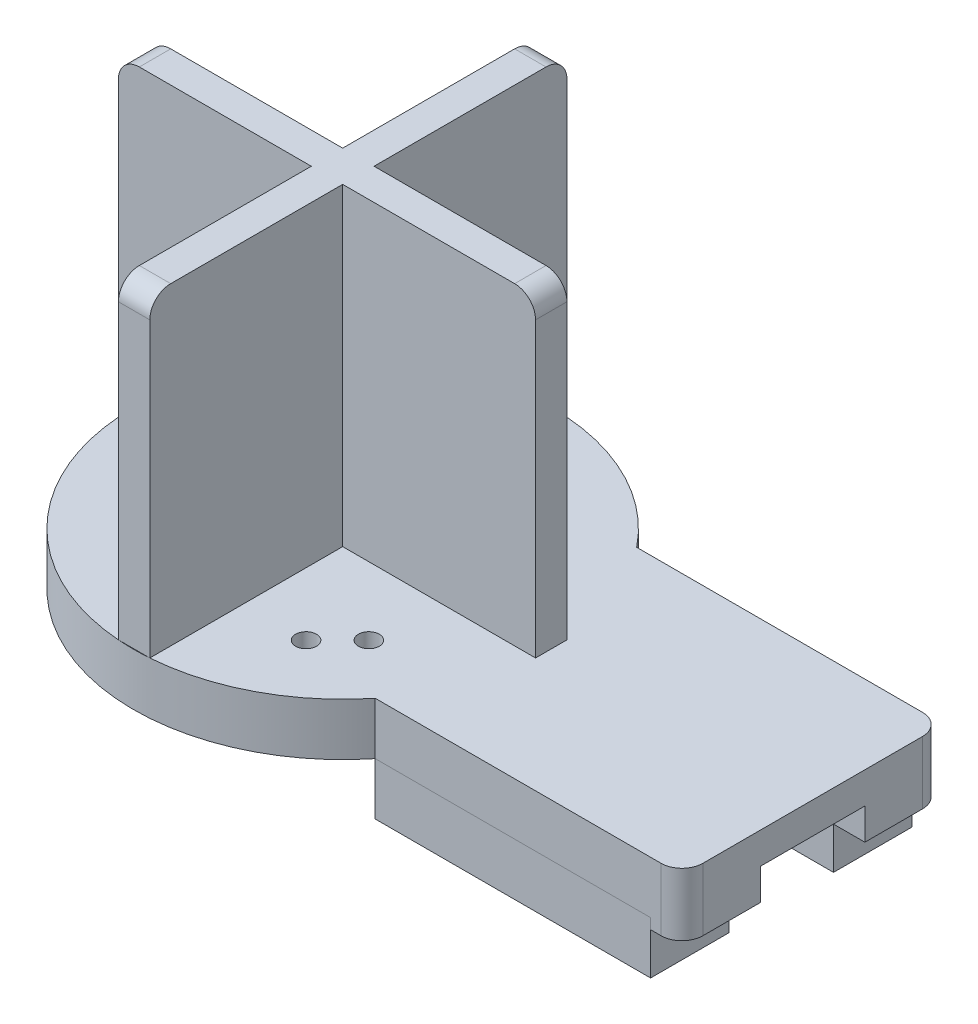
from build123d import *

# Parameters (mm, degrees)
SKETCH1_R             = 20
BOSS_EXTRUDE1_DEPTH   = 5
SKETCH2_W             = 18.443670675
SKETCH2_H             = 3
SKETCH2_W_2           = 3
SKETCH2_H_2           = 18.443670675
BOSS_EXTRUDE2_DEPTH   = 30
BOSS_EXTRUDE3_DEPTH   = 5
CUT_EXTRUDE1_DEPTH    = 2
SKETCH5_R             = 1
CUT_EXTRUDE3_DEPTH    = 58.618864391
FILLET1_R             = 2
SKETCH7_W             = 3
SKETCH7_H             = 7.51
BOSS_EXTRUDE4_DEPTH   = 1
BOSS_EXTRUDE6_DEPTH   = 5
BOSS_EXTRUDE6_2_DEPTH = 5
FILLET2_R             = 2
FILLET3_R             = 2
FILLET4_R             = 2


with BuildPart() as part:
    # Sketch1 → Boss-Extrude1 (new body)
    with BuildSketch(Plane(origin=(0, 0, 0), x_dir=(1, 0, 0), z_dir=(0, 1, 0))):
        with Locations(Location((0, 0, 0), (0, 0, 270))):
            Circle(SKETCH1_R)
    extrude(amount=BOSS_EXTRUDE1_DEPTH)

    # Sketch2 → Boss-Extrude2 (add)
    with BuildSketch(Plane(origin=(0, 5, 0), x_dir=(1, 0, 0), z_dir=(0, 1, 0))):
        with Locations((-10.721835337, 0)):
            Rectangle(SKETCH2_W, SKETCH2_H)
        Rectangle(SKETCH2_W_2, SKETCH2_H)
        with Locations((0, -10.721835337)):
            Rectangle(SKETCH2_W_2, SKETCH2_H_2)
        with Locations((0, 10.721835337)):
            Rectangle(SKETCH2_W_2, SKETCH2_H_2)
        with Locations((10.721835337, 0)):
            Rectangle(SKETCH2_W, SKETCH2_H)
    extrude(amount=BOSS_EXTRUDE2_DEPTH)

    # Sketch3 → Boss-Extrude3 (add)
    with BuildSketch(Plane(origin=(0, 5, 0), x_dir=(1, 0, 0), z_dir=(0, 1, 0))):
        Polygon((-5.056329325, 12.5), (-5.056329325, -12.5), (15.612494996, -12.5), (44.943670675, -12.5), (44.943670675, 12.5), align=None)
    extrude(amount=-BOSS_EXTRUDE3_DEPTH)

    # Sketch4 → Cut-Extrude1 (cut)
    with BuildSketch(Plane.XZ):
        with BuildLine():
            ThreePointArc((33.598149285, 4.99), (14.953670675, 0), (33.598149285, -4.99))
            Line((33.598149285, -4.99), (24.943670675, -4.99))
            Line((24.943670675, -4.99), (24.943670675, 4.99))
            Line((24.943670675, 4.99), (33.598149285, 4.99))
        make_face()
        with BuildLine():
            Line((24.943670675, -4.99), (33.598149285, -4.99))
            ThreePointArc((33.598149285, -4.99), (34.594016299, -2.58281423), (34.933670675, 0))
            ThreePointArc((34.933670675, 0), (34.594016299, 2.58281423), (33.598149285, 4.99))
            Line((33.598149285, 4.99), (24.943670675, 4.99))
            Line((24.943670675, 4.99), (24.943670675, -4.99))
        make_face()
        with BuildLine():
            Line((33.598149285, -4.99), (44.943670675, -4.99))
            Line((44.943670675, -4.99), (44.943670675, 4.99))
            Line((44.943670675, 4.99), (33.598149285, 4.99))
            ThreePointArc((33.598149285, 4.99), (34.594016299, 2.58281423), (34.933670675, 0))
            ThreePointArc((34.933670675, 0), (34.594016299, -2.58281423), (33.598149285, -4.99))
        make_face()
        with BuildLine():
            ThreePointArc((33.598149285, 4.99), (14.953670675, 0), (33.598149285, -4.99))
            Line((33.598149285, -4.99), (24.943670675, -4.99))
            Line((24.943670675, -4.99), (24.943670675, 4.99))
            Line((24.943670675, 4.99), (33.598149285, 4.99))
        make_face()
        with BuildLine():
            Line((24.943670675, -4.99), (33.598149285, -4.99))
            ThreePointArc((33.598149285, -4.99), (34.594016299, -2.58281423), (34.933670675, 0))
            ThreePointArc((34.933670675, 0), (34.594016299, 2.58281423), (33.598149285, 4.99))
            Line((33.598149285, 4.99), (24.943670675, 4.99))
            Line((24.943670675, 4.99), (24.943670675, -4.99))
        make_face()
    extrude(amount=-CUT_EXTRUDE1_DEPTH, mode=Mode.SUBTRACT)

    # Sketch5 → Cut-Extrude3 (cut, through all)
    with BuildSketch(Plane(origin=(0, 5, 0), x_dir=(1, 0, 0), z_dir=(0, 1, 0))):
        with Locations(Location((-10.5, 8, 0), (0, 0, 270))):
            Circle(SKETCH5_R)
        with Locations(Location((-7.5, 11, 0), (0, 0, 270))):
            Circle(SKETCH5_R)
        with Locations(Location((7.5, 11, 0), (0, 0, 270))):
            Circle(SKETCH5_R)
        with Locations(Location((10.5, 8, 0), (0, 0, 270))):
            Circle(SKETCH5_R)
        with Locations(Location((-10.5, -8, 0), (0, 0, 270))):
            Circle(SKETCH5_R)
        with Locations(Location((-7.5, -11, 0), (0, 0, 270))):
            Circle(SKETCH5_R)
        with Locations(Location((10.5, -8, 0), (0, 0, 270))):
            Circle(SKETCH5_R)
        with Locations(Location((7.5, -11, 0), (0, 0, 270))):
            Circle(SKETCH5_R)
    extrude(amount=-CUT_EXTRUDE3_DEPTH, mode=Mode.SUBTRACT)

    # Fillet1
    fillet1_edges = [part.edges().sort_by_distance(p)[0] for p in [
        (19.943670675, 35, 0),
        (0, 35, -19.943670675),
        (-19.943670675, 35, 0),
        (0, 35, 19.943670675),
    ]]
    fillet(fillet1_edges, radius=FILLET1_R)

    # Sketch7 → Boss-Extrude4 (add)
    with BuildSketch(Plane.XZ):
        with Locations((43.443670675, 8.745)):
            Rectangle(SKETCH7_W, SKETCH7_H)
        with Locations((43.443670675, -8.745)):
            Rectangle(SKETCH7_W, SKETCH7_H)
    extrude(amount=BOSS_EXTRUDE4_DEPTH)

    # Fillet4
    fillet4_edges = [part.edges().sort_by_distance(p)[0] for p in [
        (44.943670675, 2, 12.5),
        (44.943670675, 2, -12.5),
    ]]
    fillet(fillet4_edges, radius=FILLET4_R)


with BuildPart() as body_2:
    # Sketch8 → Boss-Extrude6 (new body)
    with BuildSketch(Plane.XZ):
        with BuildLine():
            Line((14.953670675, 13.281104372), (14.953670675, 0))
            ThreePointArc((14.953670675, 0), (22.360856445, 9.650345624), (33.598149285, 4.99))
            Line((33.598149285, 4.99), (41.943670675, 4.99))
            Line((41.943670675, 4.99), (41.943670675, 12.5))
            Line((41.943670675, 12.5), (15.612494996, 12.5))
            ThreePointArc((15.612494996, 12.5), (15.288072212, 12.894760488), (14.953670675, 13.281104372))
        make_face()
    extrude(amount=BOSS_EXTRUDE6_DEPTH)

    # Fillet2
    # the kernel refuses this fillet: 2 mm, written as the material it takes off along each edge
    with BuildSketch(Plane(origin=(14.953670675, 5.661911606, 13.281104372), x_dir=(0, 0, -1), z_dir=(0, -1, 0))) as fillet2_piece_1:
        with BuildLine():
            CenterArc((2.264764642, 2), FILLET2_R, 222.112450768, 47.887549232)
            ThreePointArc((0.781104372, 0.658824321), (0.386343884, 0.334401537), (0, 0))
            Line((0, 0), (2.264764642, 0))
        make_face()
    extrude(amount=16.323823211, mode=Mode.SUBTRACT)


with BuildPart() as body_3:
    # Sketch8 → Boss-Extrude6 2 (new body)
    with BuildSketch(Plane.XZ):
        with BuildLine():
            Line((41.943670675, -4.99), (33.598149285, -4.99))
            ThreePointArc((33.598149285, -4.99), (22.360856445, -9.650345624), (14.953670675, 0))
            Line((14.953670675, 0), (14.953670675, -13.281104372))
            ThreePointArc((14.953670675, -13.281104372), (15.288072212, -12.894760488), (15.612494996, -12.5))
            Line((15.612494996, -12.5), (41.943670675, -12.5))
            Line((41.943670675, -12.5), (41.943670675, -4.99))
        make_face()
    extrude(amount=BOSS_EXTRUDE6_2_DEPTH)

    # Fillet3
    # the kernel refuses this fillet: 2 mm, written as the material it takes off along each edge
    with BuildSketch(Plane(origin=(14.953670675, 5.661911606, -13.281104372), x_dir=(0, 0, 1), z_dir=(0, -1, 0))) as fillet3_piece_1:
        with BuildLine():
            CenterArc((2.264764642, -2), FILLET3_R, 90, 47.887549232)
            ThreePointArc((0.781104372, -0.658824321), (0.386343884, -0.334401537), (0, 0))
            Line((0, 0), (2.264764642, 0))
        make_face()
    extrude(amount=16.323823211, mode=Mode.SUBTRACT)


solid = Compound([part.part, body_2.part, body_3.part])
